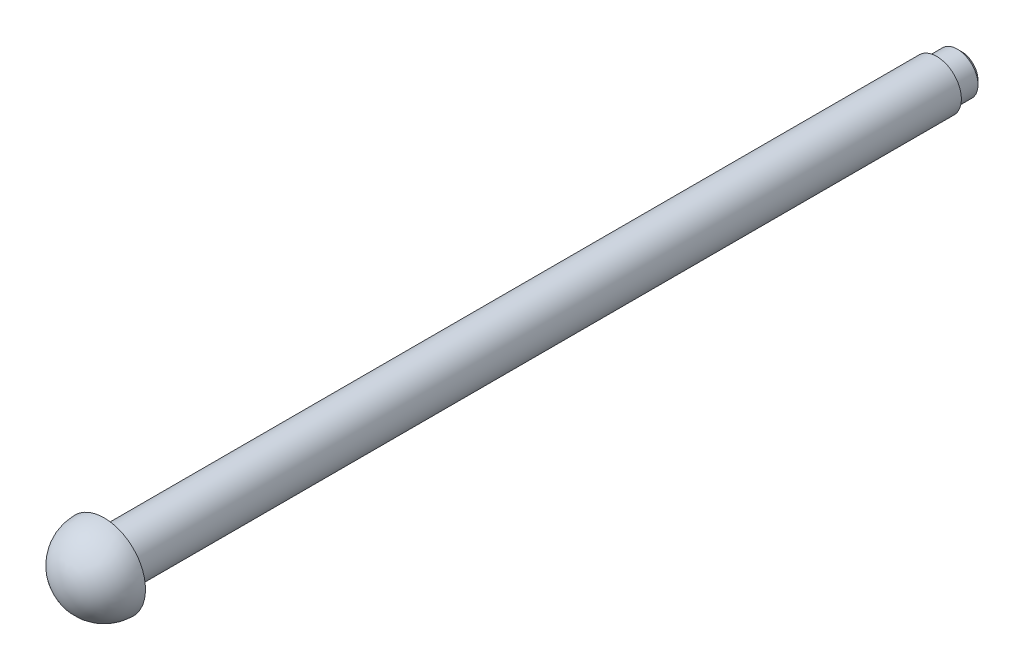
from build123d import *


# Read off the part's stored shape, not the designer's step: M2.5 Machine Threads Stud1
with BuildPart() as part:
    # Sketch1 → Revolve1 (revolve)
    with BuildSketch(Plane(origin=(0, 0, 0), x_dir=(0, 0, -1), z_dir=(1, 0, 0))):
        with BuildLine():
            Line((0, 1.49), (51.9, 1.49))
            Line((51.9, 1.49), (51.9, 0))
            Line((51.9, 0), (0, 0))
            Line((0, 0), (-2.5, 0))
            ThreePointArc((-2.5, 0), (-1.767766953, 1.767766953), (0, 2.5))
            Line((0, 2.5), (0, 1.49))
        make_face()
    revolve(axis=Axis((0, 0, 65.917114172), (0, 0, -1)))

    # M2.5 Machine Threads Stud1 outline → M2.5 Machine Threads Stud1 (revolve, cut)
    with BuildSketch(Plane.XZ):
        Polygon((0.9965, -51.9), (1.49, -51.9), (1.49, -50.4), (1.25, -50.4), (1.25, -51.6465), align=None)
    revolve(axis=Axis((0, 0, 0), (0, 0, 1)), mode=Mode.SUBTRACT)


solid = part.part
